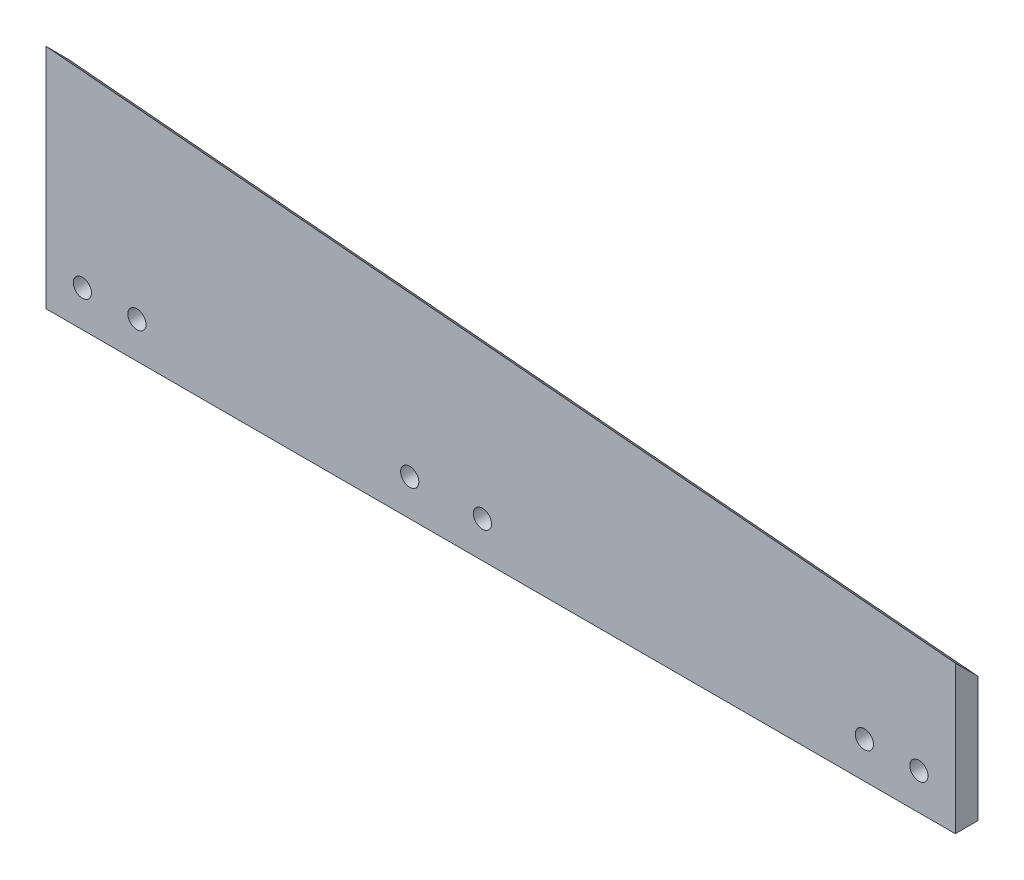
from build123d import *

# Parameters (mm, degrees)
SKETCH1_W           = 5
SKETCH1_H           = 50
BOSS_EXTRUDE1_DEPTH = 200
CUT_EXTRUDE2_DEPTH  = 5
CHAMFER1_SIZE       = 5
SKETCH2_R           = 2
CUT_EXTRUDE1_DEPTH  = 5
SKETCH4_R           = 2
CUT_EXTRUDE3_DEPTH  = 5


with BuildPart() as part:
    # Sketch1 → Boss-Extrude1 (new body)
    with BuildSketch(Plane(origin=(0, 0, 0), x_dir=(0, 0, -1), z_dir=(1, 0, 0))):
        with Locations((-2.5, 25)):
            Rectangle(SKETCH1_W, SKETCH1_H)
    extrude(amount=BOSS_EXTRUDE1_DEPTH)

    # Sketch3 → Cut-Extrude2 (cut)
    with BuildSketch(Plane.XY.offset(5)):
        Polygon((0, 50), (200, 50), (200, 32.502267295), align=None)
    extrude(amount=-CUT_EXTRUDE2_DEPTH, mode=Mode.SUBTRACT)

    # Chamfer1
    chamfer1_edges = [part.edges().sort_by_distance(p)[0] for p in [
        (100, 41.251133647, 0),
    ]]
    chamfer(chamfer1_edges, length=CHAMFER1_SIZE - 0.0001)  # a hair under: the kernel refuses the full size

    # Sketch2 → Cut-Extrude1 (cut)
    with BuildSketch(Plane(origin=(0, 0, 0), x_dir=(-1, 0, 0), z_dir=(0, 0, -1))):
        with Locations((-192, 8)):
            Circle(SKETCH2_R)
        with Locations((-180, 8)):
            Circle(SKETCH2_R)
    cut_extrude1 = extrude(amount=-CUT_EXTRUDE1_DEPTH, mode=Mode.SUBTRACT)

    # Mirror2: Cut-Extrude1 across plane
    add(cut_extrude1.mirror(Plane(origin=(100, 0, 0), x_dir=(0, 0, 1), z_dir=(1, 0, 0))), mode=Mode.SUBTRACT)

    # Sketch4 → Cut-Extrude3 (cut)
    with BuildSketch(Plane(origin=(0, 0, 0), x_dir=(-1, 0, 0), z_dir=(0, 0, -1))):
        with Locations(Location((-80, 8, 0), (0, 0, 90))):
            Circle(SKETCH4_R)
        with Locations(Location((-96, 8, 0), (0, 0, 90))):
            Circle(SKETCH4_R)
    extrude(amount=-CUT_EXTRUDE3_DEPTH, mode=Mode.SUBTRACT)


solid = part.part
